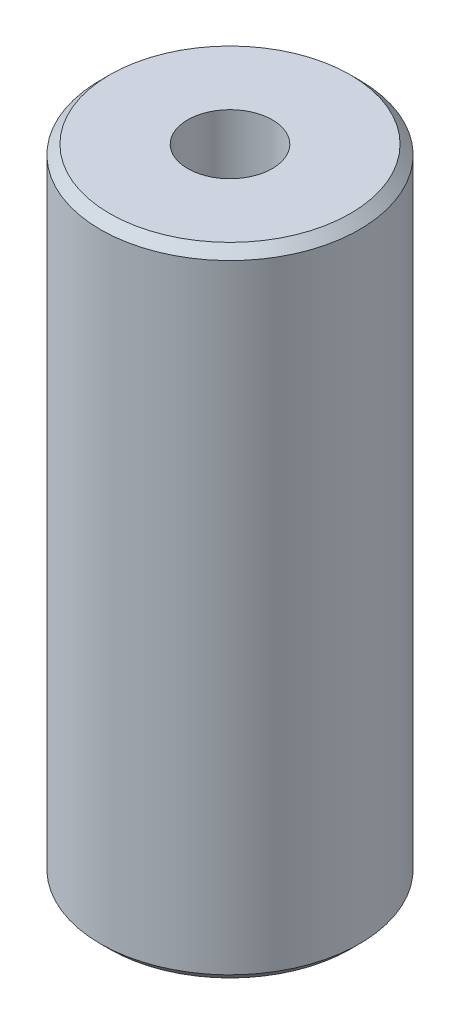
from build123d import *

# Parameters (mm, degrees)
SKETCH1_R           = 45
BOSS_EXTRUDE1_DEPTH = 221.366290044
SKETCH2_R           = 14.705469362
CUT_EXTRUDE1_DEPTH  = 231.33244315
CHAMFER1_SIZE       = 3.207483745


with BuildPart() as part:
    # Sketch1 → Boss-Extrude1 (new body)
    with BuildSketch(Plane(origin=(0, 0, 0), x_dir=(1, 0, 0), z_dir=(0, 1, 0))):
        Circle(SKETCH1_R)
    extrude(amount=BOSS_EXTRUDE1_DEPTH)

    # Sketch2 → Cut-Extrude1 (cut, through all)
    with BuildSketch(Plane(origin=(0, 0, 0), x_dir=(1, 0, 0), z_dir=(0, 1, 0))):
        Circle(SKETCH2_R)
    extrude(amount=CUT_EXTRUDE1_DEPTH, mode=Mode.SUBTRACT)

    # Chamfer1
    chamfer1_edges = [part.edges().sort_by_distance(p)[0] for p in [
        (-45, 221.366290044, 0),
        (-45, 0, 0),
    ]]
    chamfer(chamfer1_edges, length=CHAMFER1_SIZE)


solid = part.part
